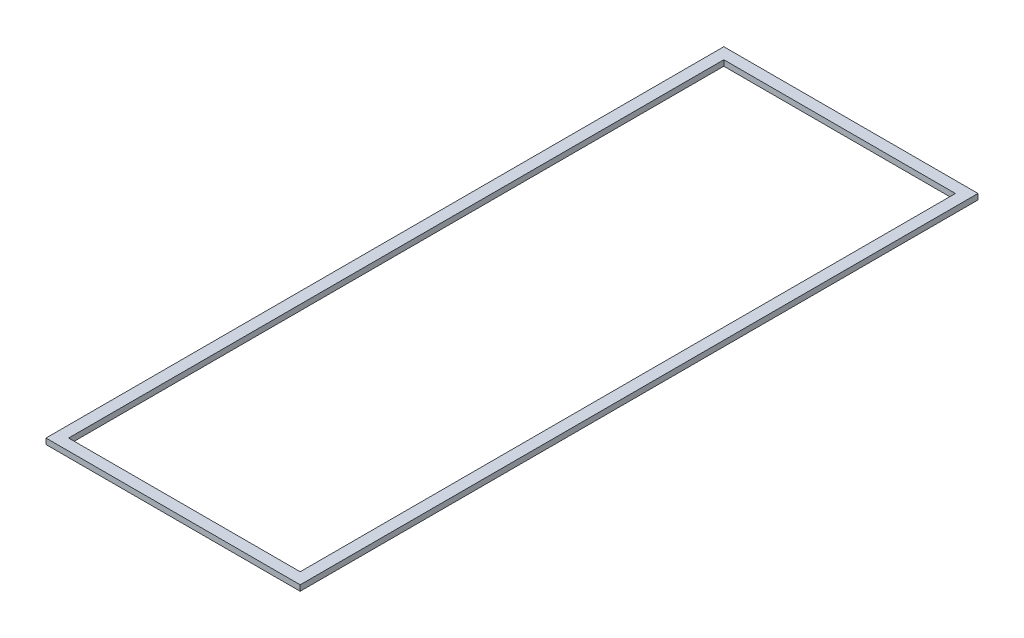
from build123d import *

# Parameters (mm, degrees)
SKETCH_1_W      = 450
SKETCH_1_H      = 1200
SKETCH_1_W_2    = 410
SKETCH_1_H_2    = 1160
EXTRUDE_1_DEPTH = 10


with BuildPart() as part:
    # Эскиз1 → Вытянуть-Тонкостенный1 (new body)
    with BuildSketch(Plane(origin=(0, 0, 0), x_dir=(1, 0, 0), z_dir=(0, 1, 0))):
        with Locations((225, 600)):
            Rectangle(SKETCH_1_W, SKETCH_1_H)
        with Locations((225, 600)):
            Rectangle(SKETCH_1_W_2, SKETCH_1_H_2, mode=Mode.SUBTRACT)
    extrude(amount=EXTRUDE_1_DEPTH)


solid = part.part
